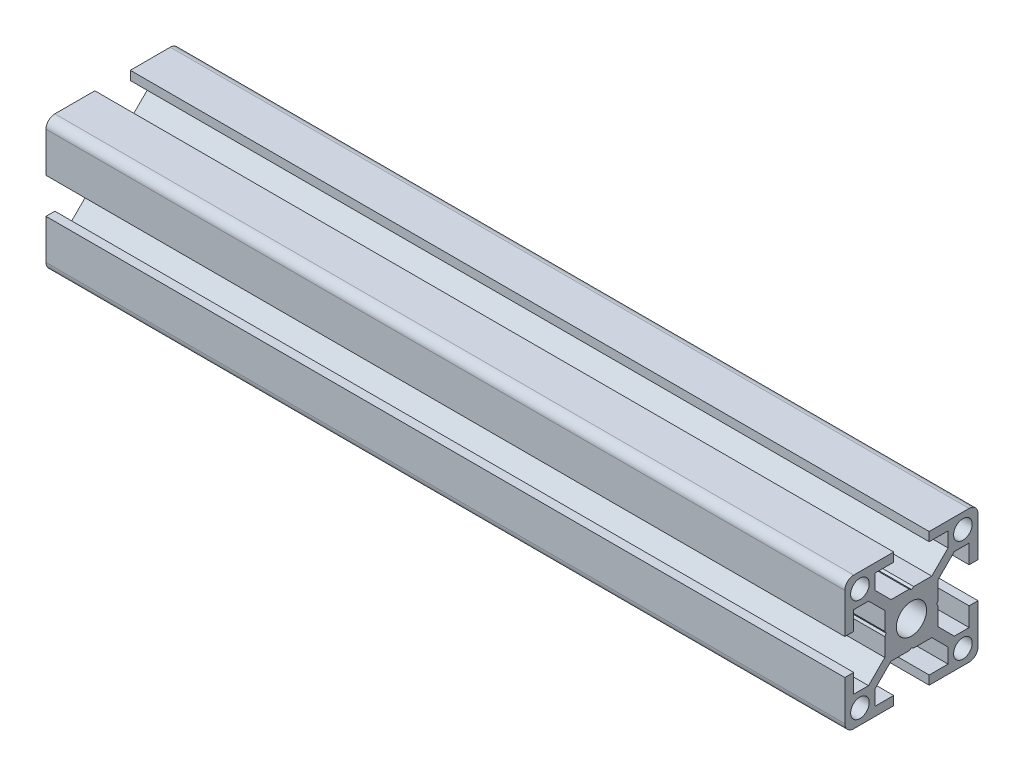
from build123d import *

# Parameters (mm, degrees)
SKETCH1_R           = 3.4
SKETCH1_R_2         = 2.1
BOSS_EXTRUDE1_DEPTH = 180


with BuildPart() as part:
    # Sketch1 → Boss-Extrude1 (new body)
    with BuildSketch(Plane(origin=(0, 0, 0), x_dir=(0, -1, 0), z_dir=(-1, 0, 0))):
        with BuildLine():
            Line((13, -4), (13, -8.25))
            Line((13, -8.25), (9.664213562, -8.25))
            Line((9.664213562, -8.25), (6, -4.585786438))
            Line((6, -4.585786438), (6, -0.519615242))
            Line((6, -0.519615242), (5.7, 0))
            Line((5.7, 0), (6, 0.519615242))
            Line((6, 0.519615242), (6, 4.585786438))
            Line((6, 4.585786438), (9.664213562, 8.25))
            Line((9.664213562, 8.25), (13, 8.25))
            Line((13, 8.25), (13, 4))
            Line((13, 4), (15, 4))
            Line((15, 4), (15, 13))
            ThreePointArc((15, 13), (14.414213562, 14.414213562), (13, 15))
            Line((13, 15), (4, 15))
            Line((4, 15), (4, 13))
            Line((4, 13), (8.25, 13))
            Line((8.25, 13), (8.25, 9.664213562))
            Line((8.25, 9.664213562), (4.585786438, 6))
            Line((4.585786438, 6), (0.519615242, 6))
            Line((0.519615242, 6), (0, 5.7))
            Line((0, 5.7), (-0.519615242, 6))
            Line((-0.519615242, 6), (-4.585786438, 6))
            Line((-4.585786438, 6), (-8.25, 9.664213562))
            Line((-8.25, 9.664213562), (-8.25, 13))
            Line((-8.25, 13), (-4, 13))
            Line((-4, 13), (-4, 15))
            Line((-4, 15), (-13, 15))
            ThreePointArc((-13, 15), (-14.414213562, 14.414213562), (-15, 13))
            Line((-15, 13), (-15, 4))
            Line((-15, 4), (-13, 4))
            Line((-13, 4), (-13, 8.25))
            Line((-13, 8.25), (-9.664213562, 8.25))
            Line((-9.664213562, 8.25), (-6, 4.585786438))
            Line((-6, 4.585786438), (-6, 0.519615242))
            Line((-6, 0.519615242), (-5.7, 0))
            Line((-5.7, 0), (-6, -0.519615242))
            Line((-6, -0.519615242), (-6, -4.585786438))
            Line((-6, -4.585786438), (-9.664213562, -8.25))
            Line((-9.664213562, -8.25), (-13, -8.25))
            Line((-13, -8.25), (-13, -4))
            Line((-13, -4), (-15, -4))
            Line((-15, -4), (-15, -13))
            ThreePointArc((-15, -13), (-14.414213562, -14.414213562), (-13, -15))
            Line((-13, -15), (-4, -15))
            Line((-4, -15), (-4, -13))
            Line((-4, -13), (-8.25, -13))
            Line((-8.25, -13), (-8.25, -9.664213562))
            Line((-8.25, -9.664213562), (-4.585786438, -6))
            Line((-4.585786438, -6), (-0.519615242, -6))
            Line((-0.519615242, -6), (0, -5.7))
            Line((0, -5.7), (0.519615242, -6))
            Line((0.519615242, -6), (4.585786438, -6))
            Line((4.585786438, -6), (8.25, -9.664213562))
            Line((8.25, -9.664213562), (8.25, -13))
            Line((8.25, -13), (4, -13))
            Line((4, -13), (4, -15))
            Line((4, -15), (13, -15))
            ThreePointArc((13, -15), (14.414213562, -14.414213562), (15, -13))
            Line((15, -13), (15, -4))
            Line((15, -4), (13, -4))
        make_face()
        Circle(SKETCH1_R, mode=Mode.SUBTRACT)
        with Locations((11.6, -11.6)):
            Circle(SKETCH1_R_2, mode=Mode.SUBTRACT)
        with Locations((11.6, 11.6)):
            Circle(SKETCH1_R_2, mode=Mode.SUBTRACT)
        with Locations((-11.6, 11.6)):
            Circle(SKETCH1_R_2, mode=Mode.SUBTRACT)
        with Locations((-11.6, -11.6)):
            Circle(SKETCH1_R_2, mode=Mode.SUBTRACT)
    extrude(amount=-BOSS_EXTRUDE1_DEPTH)


solid = part.part
